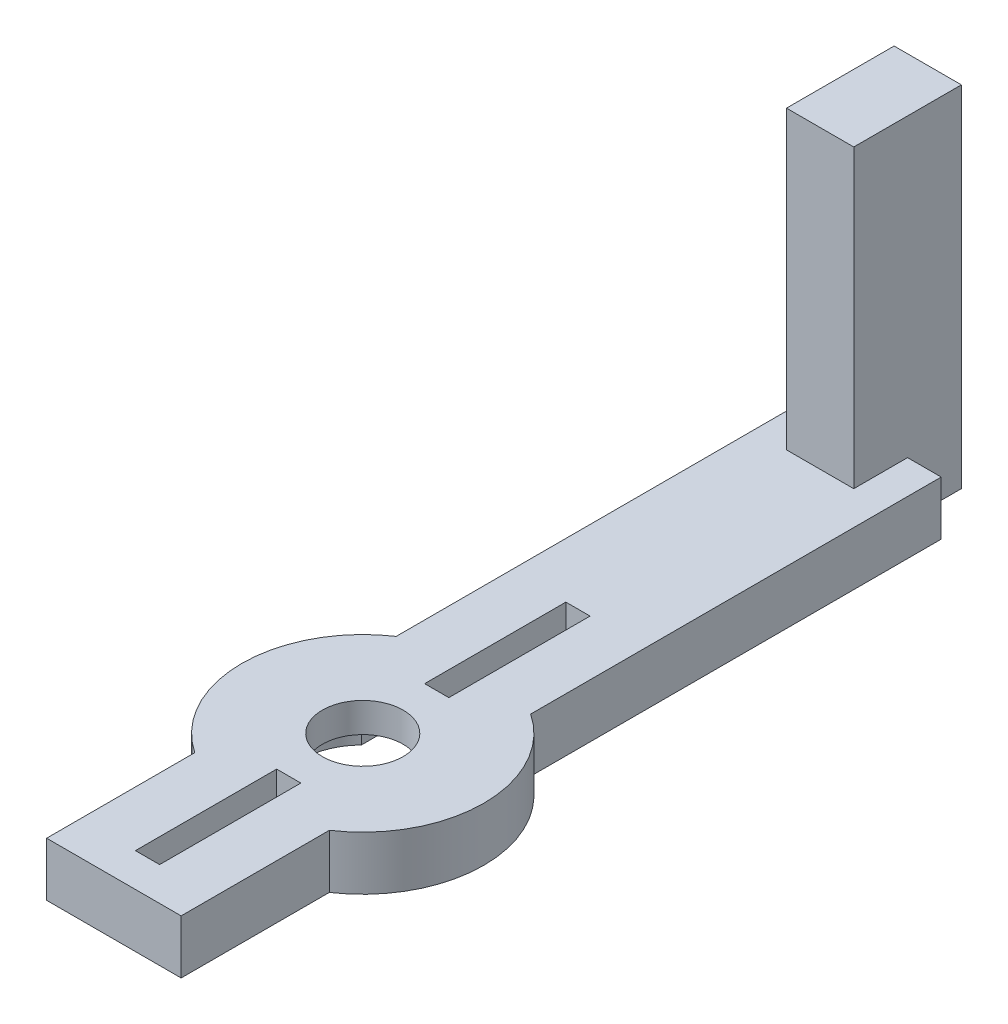
from build123d import *

# Parameters (mm, degrees)
BOSS_EXTRUDE1_START = 63.6
SKETCH1_R           = 9
BOSS_EXTRUDE1_DEPTH = 4
BOSS_EXTRUDE2_START = -100
SKETCH2_W           = 10
SKETCH2_H           = 4
BOSS_EXTRUDE2_DEPTH = 56.5
BOSS_EXTRUDE3_START = -104
SKETCH3_W           = 5
SKETCH3_H           = 26
BOSS_EXTRUDE3_DEPTH = 8
BOSS_EXTRUDE4_START = 63.1
SKETCH4_R           = 4.6
BOSS_EXTRUDE4_DEPTH = 2.3
BOSS_EXTRUDE5_START = -62
SKETCH5_W           = 6.6
SKETCH5_H           = 2.3
BOSS_EXTRUDE5_DEPTH = 17.5
BOSS_EXTRUDE6_START = -56.5
SKETCH6_W           = 1.8
SKETCH6_H           = 6
BOSS_EXTRUDE6_DEPTH = 10.5
BOSS_EXTRUDE7_START = -79.5
SKETCH7_W           = 6.6
SKETCH7_H           = 2.3
BOSS_EXTRUDE7_DEPTH = 17.5
BOSS_EXTRUDE8_START = -78
SKETCH8_W           = 1.8
SKETCH8_H           = 6
BOSS_EXTRUDE8_DEPTH = 10.5
BOSS_EXTRUDE9_START = 62.6
SKETCH9_R           = 3
BOSS_EXTRUDE9_DEPTH = 6


with BuildPart() as part:
    # Sketch1 → Boss-Extrude1 (new body)
    with BuildSketch(Plane(origin=(0, 0, 0), x_dir=(1, 0, 0), z_dir=(0, 1, 0)).offset(BOSS_EXTRUDE1_START)):
        with Locations((0, 62)):
            Circle(SKETCH1_R)
    extrude(amount=BOSS_EXTRUDE1_DEPTH)

    # Sketch2 → Boss-Extrude2 (add)
    with BuildSketch(Plane.XY.offset(BOSS_EXTRUDE2_START)):
        with Locations((0, 65.6)):
            Rectangle(SKETCH2_W, SKETCH2_H)
    extrude(amount=BOSS_EXTRUDE2_DEPTH)

    # Sketch3 → Boss-Extrude3 (add)
    with BuildSketch(Plane.XY.offset(BOSS_EXTRUDE3_START)):
        with Locations((0, 76.6)):
            Rectangle(SKETCH3_W, SKETCH3_H)
    extrude(amount=BOSS_EXTRUDE3_DEPTH)


with BuildPart() as body_2:
    # Sketch4 → Boss-Extrude4 (new body)
    with BuildSketch(Plane(origin=(0, 0, 0), x_dir=(1, 0, 0), z_dir=(0, 1, 0)).offset(BOSS_EXTRUDE4_START)):
        with Locations((0, 62)):
            Circle(SKETCH4_R)
    extrude(amount=BOSS_EXTRUDE4_DEPTH)


with BuildPart() as part_1:
    add(part.part)

    # Combine1: cut body 2
    add(body_2.part, mode=Mode.SUBTRACT)


with BuildPart() as body_2_2:
    # Sketch5 → Boss-Extrude5 (new body)
    with BuildSketch(Plane.XY.offset(BOSS_EXTRUDE5_START)):
        with Locations((0, 64.25)):
            Rectangle(SKETCH5_W, SKETCH5_H)
    extrude(amount=BOSS_EXTRUDE5_DEPTH)


with BuildPart() as part_2:
    add(part_1.part)

    # Combine2: cut body 2 2
    add(body_2_2.part, mode=Mode.SUBTRACT)


with BuildPart() as body_2_3:
    # Sketch6 → Boss-Extrude6 (new body)
    with BuildSketch(Plane.XY.offset(BOSS_EXTRUDE6_START)):
        with Locations((0, 65.6)):
            Rectangle(SKETCH6_W, SKETCH6_H)
    extrude(amount=BOSS_EXTRUDE6_DEPTH)


with BuildPart() as part_3:
    add(part_2.part)

    # Combine3: cut body 2 3
    add(body_2_3.part, mode=Mode.SUBTRACT)


with BuildPart() as body_2_4:
    # Sketch7 → Boss-Extrude7 (new body)
    with BuildSketch(Plane.XY.offset(BOSS_EXTRUDE7_START)):
        with Locations((0, 64.25)):
            Rectangle(SKETCH7_W, SKETCH7_H)
    extrude(amount=BOSS_EXTRUDE7_DEPTH)


with BuildPart() as part_4:
    add(part_3.part)

    # Combine4: cut body 2 4
    add(body_2_4.part, mode=Mode.SUBTRACT)


with BuildPart() as body_2_5:
    # Sketch8 → Boss-Extrude8 (new body)
    with BuildSketch(Plane.XY.offset(BOSS_EXTRUDE8_START)):
        with Locations((0, 65.6)):
            Rectangle(SKETCH8_W, SKETCH8_H)
    extrude(amount=BOSS_EXTRUDE8_DEPTH)


with BuildPart() as part_5:
    add(part_4.part)

    # Combine5: cut body 2 5
    add(body_2_5.part, mode=Mode.SUBTRACT)


with BuildPart() as body_2_6:
    # Sketch9 → Boss-Extrude9 (new body)
    with BuildSketch(Plane(origin=(0, 0, 0), x_dir=(1, 0, 0), z_dir=(0, 1, 0)).offset(BOSS_EXTRUDE9_START)):
        with Locations((0, 62)):
            Circle(SKETCH9_R)
    extrude(amount=BOSS_EXTRUDE9_DEPTH)


with BuildPart() as part_6:
    add(part_5.part)

    # Combine6: cut body 2 6
    add(body_2_6.part, mode=Mode.SUBTRACT)


solid = part_6.part
